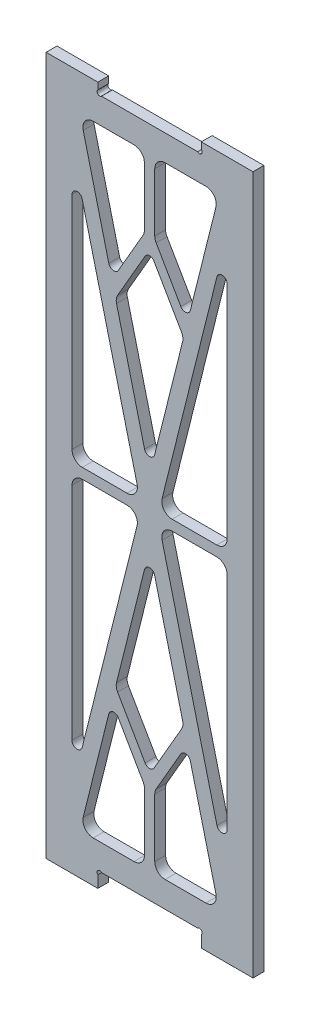
from build123d import *

# Parameters (mm, degrees)
SKETCH_1_W        = 30
SKETCH_1_H        = 120
EXTRUDE_1_DEPTH   = 1.05
EXTRUDE_1_2_DEPTH = 2.1
EXTRUDE_START     = -2.1
EXTRUDE_3_DEPTH   = 2.1
FILLET_1_R        = 1
FILLET_2_R        = 2
FILLET_3_R        = 1


# Read off the part's stored shape, not the designer's step: 拉伸-薄壁3
with BuildPart() as part:
    # 草图1 → Extrude 1 (new, symmetric)
    with BuildSketch(Plane.XY):
        with BuildLine():
            Line((20, -68), (20, 67))
            Line((20, 67), (10, 67))
            Line((10, 67), (10, 65.707106781))
            ThreePointArc((10, 65.707106781), (10, 65), (9.292893219, 65))
            Line((9.292893219, 65), (-9.292893219, 65))
            ThreePointArc((-9.292893219, 65), (-10, 65), (-10, 65.707106781))
            Line((-10, 65.707106781), (-10, 67))
            Line((-10, 67), (-20, 67))
            Line((-20, 67), (-20, -68))
            Line((-20, -68), (-10, -68))
            Line((-10, -68), (-10, -65.707106781))
            ThreePointArc((-10, -65.707106781), (-10, -65), (-9.292893219, -65))
            Line((-9.292893219, -65), (9.292893219, -65))
            ThreePointArc((9.292893219, -65), (10, -65), (10, -65.707106781))
            Line((10, -65.707106781), (10, -68))
            Line((10, -68), (20, -68))
        make_face()
        Rectangle(SKETCH_1_W, SKETCH_1_H, mode=Mode.SUBTRACT)
    extrude(amount=EXTRUDE_1_DEPTH, both=True)

    # 草图2 → Extrude 1 2 (add)
    with BuildSketch(Plane.XY.offset(1.05)):
        Polygon((13.54478625, 60.363803438), (-16.45521375, -59.636196562), (-13.54478625, -60.363803438), (16.45521375, 59.636196562), align=None)
        Polygon((16.45521375, -59.636196562), (-13.54478625, 60.363803438), (-16.45521375, 59.636196562), (13.54478625, -60.363803438), align=None)
    extrude(amount=-EXTRUDE_1_2_DEPTH)

    # 拉伸-薄壁3 outline → 拉伸-薄壁3 (add)
    with BuildSketch(Plane.XY.offset(1.05).offset(EXTRUDE_START)):
        Polygon((15, 1), (1.79616461, 1), (1.54616461, 0), (1.79616461, -1), (15, -1), align=None)
        Polygon((-1.79616461, 1), (-15, 1), (-15, -1), (-1.79616461, -1), (-1.54616461, 0), align=None)
        Polygon((1, 46.191241385), (1, 60), (-1, 60), (-1, 46.191241385), (-7.281623132, 35.311150966), (-6.583792611, 32.519828883), (0, 43.923292192), (6.583792611, 32.519828883), (7.281623132, 35.311150966), align=None)
    extrude_3 = extrude(amount=EXTRUDE_3_DEPTH)

    # 镜向1: 拉伸-薄壁3 across plane
    add(extrude_3.mirror(Plane.ZX))

    # 圆角1
    fillet_1_edges = [part.edges().sort_by_distance(p)[0] for p in [
        (15, 53.815341562, 0),
        (0, 6.184658438, 0),
        (15, -53.815341562, 0),
        (0, -6.184658438, 0),
        (-15, -53.815341562, 0),
        (-15, 53.815341562, 0),
    ]]
    fillet(fillet_1_edges, radius=FILLET_1_R)

    # 圆角2
    fillet_2_edges = [part.edges().sort_by_distance(p)[0] for p in [
        (13.45383539, -60, 0),
        (-13.45383539, -60, 0),
        (-13.45383539, 60, 0),
        (13.45383539, 60, 0),
        (1.79616461, 1, 0),
        (1.79616461, -1, 0),
        (-1.79616461, -1, 0),
        (-1.79616461, 1, 0),
        (-15, 1, 0),
        (15, 1, 0),
        (-15, -1, 0),
        (15, -1, 0),
        (6.583792611, 32.519828883, 0),
        (-6.583792611, 32.519828883, 0),
        (1, 60, 0),
        (-1, 60, 0),
        (-1, 46.191241385, 0),
        (1, 46.191241385, 0),
        (-6.583792611, -32.519828883, 0),
        (6.583792611, -32.519828883, 0),
        (1, -46.191241385, 0),
        (-1, -46.191241385, 0),
        (-1, -60, 0),
        (1, -60, 0),
    ]]
    fillet(fillet_2_edges, radius=FILLET_2_R)

    # 圆角3
    fillet_3_edges = [part.edges().sort_by_distance(p)[0] for p in [
        (7.281623132, 35.311150966, 0),
        (-7.281623132, 35.311150966, 0),
        (0, 43.923292192, 0),
        (-7.281623132, -35.311150966, 0),
        (7.281623132, -35.311150966, 0),
        (0, -43.923292192, 0),
    ]]
    fillet(fillet_3_edges, radius=FILLET_3_R)


solid = part.part
